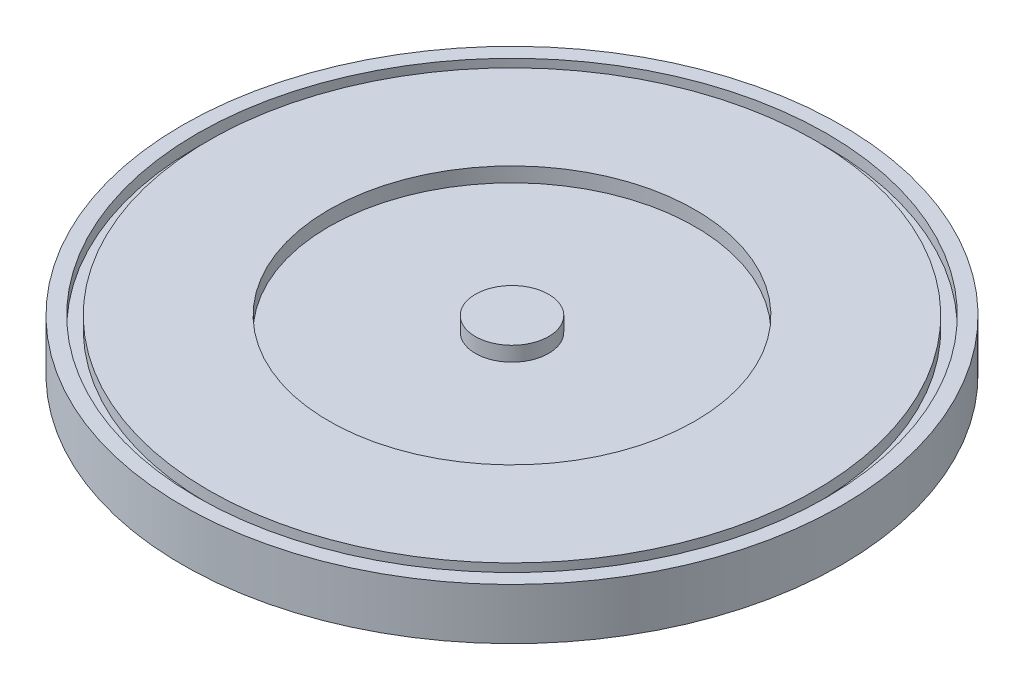
from build123d import *

# Parameters (mm, degrees)
O_RINGS_PROFILE_W = 2.032
O_RINGS_PROFILE_H = 2.032


with BuildPart() as part:
    # Main Shape Profile → Main Shape (revolve)
    with BuildSketch(Plane.XY):
        Polygon((57.15, 0), (57.15, 8.89), (31.75, 8.89), (31.75, 6.35), (6.35, 6.35), (6.35, 8.89), (0, 8.89), (0, 0), align=None)
    revolve(axis=Axis((0, 0, 0), (0, -1, 0)))

    # O Rings Profile → O-Rings Cutout (revolve, cut)
    with BuildSketch(Plane.XY):
        with Locations((53.594, 7.874)):
            Rectangle(O_RINGS_PROFILE_W, O_RINGS_PROFILE_H)
        with Locations((53.594, 1.016)):
            Rectangle(O_RINGS_PROFILE_W, O_RINGS_PROFILE_H)
    revolve(axis=Axis((0, 0, 0), (0, -1, 0)), mode=Mode.SUBTRACT)


solid = part.part
